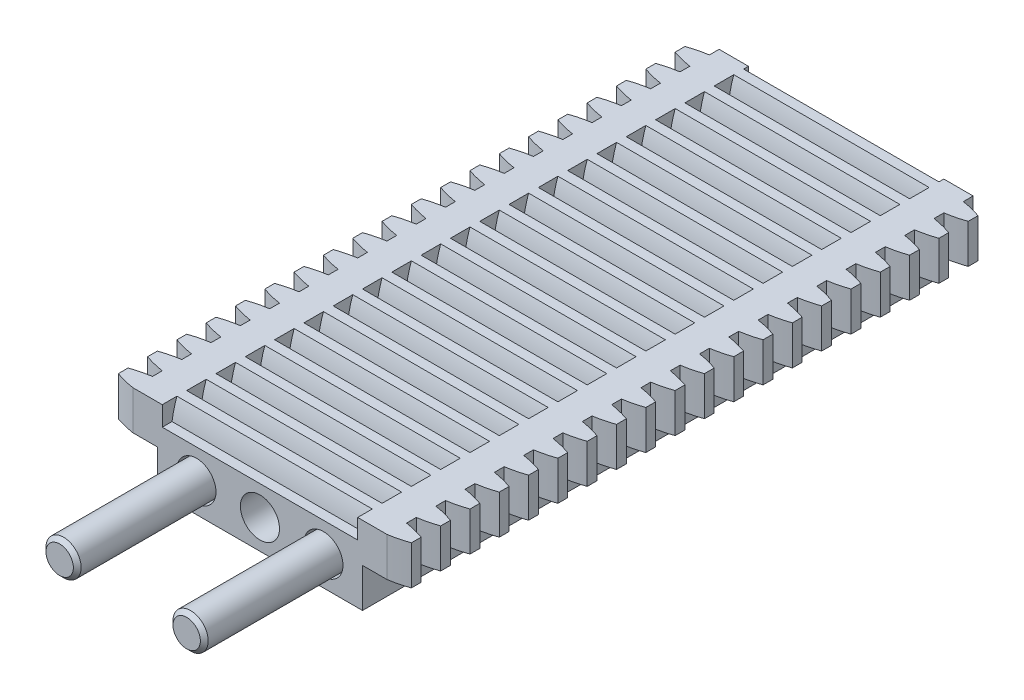
from build123d import *

# Parameters (mm, degrees)
EXTRUDE_1_DEPTH        = 60
EXTRUDE_START          = -3
EXTRUDE_2_DEPTH        = 54
SKETCH_3_R             = 1
CUT_EXTRUDE_1_DEPTH    = 61.483468816
EXTRUDE_3_DEPTH        = 7
EXTRUDE_3_DEPTH_BACK   = 7
SKETCH_4_R             = 0.9
EXTRUDE_3_2_DEPTH      = 7
EXTRUDE_3_2_DEPTH_BACK = 7
FILLET_1_R             = 0.1
CHAMFER_2_SIZE         = 0.2
CHAMFER_3_SIZE         = 0.2
EXTRUDE_4_DEPTH        = 2
CUT_EXTRUDE_2_DEPTH    = 5
CUT_EXTRUDE_START      = 5
CUT_EXTRUDE_3_DEPTH    = 5
CUT_EXTRUDE_4_DEPTH    = 61.815294129
CUT_EXTRUDE_5_DEPTH    = 3


with BuildPart() as part:
    # 草图1 → 凸台-拉伸1 (new body)
    with BuildSketch(Plane.XY):
        Polygon((5.25, 2), (6.5, 2), (6.5, 4), (-6.5, 4), (-6.5, 2), (-5.25, 2), (-5.25, 0), (5.25, 0), align=None)
    extrude(amount=-EXTRUDE_1_DEPTH)

    # 草图2 → 凸台-拉伸2 (add)
    with BuildSketch(Plane.XY.offset(EXTRUDE_START)):
        with BuildLine():
            Line((-1.95, -1.555590279), (-1.95, -2.5))
            Line((-1.95, -2.5), (-1.165769145, -2.5))
            Line((-1.165769145, -2.5), (0, 0))
            Line((0, 0), (-1.5, 0))
            Line((-1.5, 0), (-1.5, -0.677124344))
            ThreePointArc((-1.5, -0.677124344), (-1.780042303, -1.088161527), (-1.95, -1.555590279))
        make_face()
        with BuildLine():
            Line((1.5, 0), (0, 0))
            Line((0, 0), (1.165769145, -2.5))
            Line((1.165769145, -2.5), (1.95, -2.5))
            Line((1.95, -2.5), (1.95, -1.555590279))
            ThreePointArc((1.95, -1.555590279), (1.780042303, -1.088161527), (1.5, -0.677124344))
            Line((1.5, -0.677124344), (1.5, 0))
        make_face()
    extrude(amount=-EXTRUDE_2_DEPTH)

    # 草图3 → 切除-拉伸1 (cut, through all)
    with BuildSketch(Plane.XY):
        with Locations((-3.25, 1.5)):
            Circle(SKETCH_3_R)
        with Locations((0, 1.5)):
            Circle(SKETCH_3_R)
        with Locations((3.25, 1.5)):
            Circle(SKETCH_3_R)
    extrude(amount=-CUT_EXTRUDE_1_DEPTH, mode=Mode.SUBTRACT)

    # 圆角1
    fillet_1_edges = [part.edges().sort_by_distance(p)[0] for p in [
        (-1.557884573, -2.5, -57),
        (-1.165769145, -2.5, -30),
        (-1.95, -2.5, -30),
        (-1.557884573, -2.5, -3),
        (1.557884573, -2.5, -57),
        (1.95, -2.5, -30),
        (1.165769145, -2.5, -30),
        (1.557884573, -2.5, -3),
    ]]
    fillet(fillet_1_edges, radius=FILLET_1_R)

    # 草图6 → 凸台-拉伸4 (add)
    with BuildSketch(Plane(origin=(0, 4, 0), x_dir=(1, 0, 0), z_dir=(0, 1, 0))):
        with BuildLine():
            Line((-6.5, 59.5), (-6.5, 58.5))
            ThreePointArc((-6.5, 58.5), (-7.005883165, 58.601467338), (-7.5, 58.75))
            Line((-7.5, 58.75), (-7.5, 59.25))
            ThreePointArc((-7.5, 59.25), (-7.005883165, 59.398532662), (-6.5, 59.5))
        make_face()
        with BuildLine():
            Line((-6.5, 58), (-6.5, 57))
            ThreePointArc((-6.5, 57), (-7.005883165, 57.101467338), (-7.5, 57.25))
            Line((-7.5, 57.25), (-7.5, 57.75))
            ThreePointArc((-7.5, 57.75), (-7.005883165, 57.898532662), (-6.5, 58))
        make_face()
        with BuildLine():
            Line((-7.5, 56.25), (-7.5, 55.75))
            ThreePointArc((-7.5, 55.75), (-7.005883165, 55.601467338), (-6.5, 55.5))
            Line((-6.5, 55.5), (-6.5, 56.5))
            ThreePointArc((-6.5, 56.5), (-7.005883165, 56.398532662), (-7.5, 56.25))
        make_face()
        with BuildLine():
            Line((-7.5, 54.75), (-7.5, 54.25))
            ThreePointArc((-7.5, 54.25), (-7.005883165, 54.101467338), (-6.5, 54))
            Line((-6.5, 54), (-6.5, 55))
            ThreePointArc((-6.5, 55), (-7.005883165, 54.898532662), (-7.5, 54.75))
        make_face()
        with BuildLine():
            Line((-7.5, 53.25), (-7.5, 52.75))
            ThreePointArc((-7.5, 52.75), (-7.005883165, 52.601467338), (-6.5, 52.5))
            Line((-6.5, 52.5), (-6.5, 53.5))
            ThreePointArc((-6.5, 53.5), (-7.005883165, 53.398532662), (-7.5, 53.25))
        make_face()
        with BuildLine():
            Line((-7.5, 51.75), (-7.5, 51.25))
            ThreePointArc((-7.5, 51.25), (-7.005883165, 51.101467338), (-6.5, 51))
            Line((-6.5, 51), (-6.5, 52))
            ThreePointArc((-6.5, 52), (-7.005883165, 51.898532662), (-7.5, 51.75))
        make_face()
        with BuildLine():
            Line((-7.5, 50.25), (-7.5, 49.75))
            ThreePointArc((-7.5, 49.75), (-7.005883165, 49.601467338), (-6.5, 49.5))
            Line((-6.5, 49.5), (-6.5, 50.5))
            ThreePointArc((-6.5, 50.5), (-7.005883165, 50.398532662), (-7.5, 50.25))
        make_face()
        with BuildLine():
            Line((-7.5, 48.75), (-7.5, 48.25))
            ThreePointArc((-7.5, 48.25), (-7.005883165, 48.101467338), (-6.5, 48))
            Line((-6.5, 48), (-6.5, 49))
            ThreePointArc((-6.5, 49), (-7.005883165, 48.898532662), (-7.5, 48.75))
        make_face()
        with BuildLine():
            Line((-7.5, 47.25), (-7.5, 46.75))
            ThreePointArc((-7.5, 46.75), (-7.005883165, 46.601467338), (-6.5, 46.5))
            Line((-6.5, 46.5), (-6.5, 47.5))
            ThreePointArc((-6.5, 47.5), (-7.005883165, 47.398532662), (-7.5, 47.25))
        make_face()
        with BuildLine():
            Line((-7.5, 45.75), (-7.5, 45.25))
            ThreePointArc((-7.5, 45.25), (-7.005883165, 45.101467338), (-6.5, 45))
            Line((-6.5, 45), (-6.5, 46))
            ThreePointArc((-6.5, 46), (-7.005883165, 45.898532662), (-7.5, 45.75))
        make_face()
        with BuildLine():
            Line((-7.5, 44.25), (-7.5, 43.75))
            ThreePointArc((-7.5, 43.75), (-7.005883165, 43.601467338), (-6.5, 43.5))
            Line((-6.5, 43.5), (-6.5, 44.5))
            ThreePointArc((-6.5, 44.5), (-7.005883165, 44.398532662), (-7.5, 44.25))
        make_face()
        with BuildLine():
            Line((-7.5, 42.75), (-7.5, 42.25))
            ThreePointArc((-7.5, 42.25), (-7.005883165, 42.101467338), (-6.5, 42))
            Line((-6.5, 42), (-6.5, 43))
            ThreePointArc((-6.5, 43), (-7.005883165, 42.898532662), (-7.5, 42.75))
        make_face()
        with BuildLine():
            Line((-7.5, 41.25), (-7.5, 40.75))
            ThreePointArc((-7.5, 40.75), (-7.005883165, 40.601467338), (-6.5, 40.5))
            Line((-6.5, 40.5), (-6.5, 41.5))
            ThreePointArc((-6.5, 41.5), (-7.005883165, 41.398532662), (-7.5, 41.25))
        make_face()
        with BuildLine():
            Line((-7.5, 39.75), (-7.5, 39.25))
            ThreePointArc((-7.5, 39.25), (-7.005883165, 39.101467338), (-6.5, 39))
            Line((-6.5, 39), (-6.5, 40))
            ThreePointArc((-6.5, 40), (-7.005883165, 39.898532662), (-7.5, 39.75))
        make_face()
        with BuildLine():
            Line((-7.5, 38.25), (-7.5, 37.75))
            ThreePointArc((-7.5, 37.75), (-7.005883165, 37.601467338), (-6.5, 37.5))
            Line((-6.5, 37.5), (-6.5, 38.5))
            ThreePointArc((-6.5, 38.5), (-7.005883165, 38.398532662), (-7.5, 38.25))
        make_face()
        with BuildLine():
            Line((-7.5, 36.75), (-7.5, 36.25))
            ThreePointArc((-7.5, 36.25), (-7.005883165, 36.101467338), (-6.5, 36))
            Line((-6.5, 36), (-6.5, 37))
            ThreePointArc((-6.5, 37), (-7.005883165, 36.898532662), (-7.5, 36.75))
        make_face()
        with BuildLine():
            Line((-7.5, 35.25), (-7.5, 34.75))
            ThreePointArc((-7.5, 34.75), (-7.005883165, 34.601467338), (-6.5, 34.5))
            Line((-6.5, 34.5), (-6.5, 35.5))
            ThreePointArc((-6.5, 35.5), (-7.005883165, 35.398532662), (-7.5, 35.25))
        make_face()
        with BuildLine():
            Line((-7.5, 33.75), (-7.5, 33.25))
            ThreePointArc((-7.5, 33.25), (-7.005883165, 33.101467338), (-6.5, 33))
            Line((-6.5, 33), (-6.5, 34))
            ThreePointArc((-6.5, 34), (-7.005883165, 33.898532662), (-7.5, 33.75))
        make_face()
        with BuildLine():
            Line((-7.5, 32.25), (-7.5, 31.75))
            ThreePointArc((-7.5, 31.75), (-7.005883165, 31.601467338), (-6.5, 31.5))
            Line((-6.5, 31.5), (-6.5, 32.5))
            ThreePointArc((-6.5, 32.5), (-7.005883165, 32.398532662), (-7.5, 32.25))
        make_face()
        with BuildLine():
            Line((-7.5, 30.75), (-7.5, 30.25))
            ThreePointArc((-7.5, 30.25), (-7.005883165, 30.101467338), (-6.5, 30))
            Line((-6.5, 30), (-6.5, 31))
            ThreePointArc((-6.5, 31), (-7.005883165, 30.898532662), (-7.5, 30.75))
        make_face()
        with BuildLine():
            Line((-7.5, 29.25), (-7.5, 28.75))
            ThreePointArc((-7.5, 28.75), (-7.005883165, 28.601467338), (-6.5, 28.5))
            Line((-6.5, 28.5), (-6.5, 29.5))
            ThreePointArc((-6.5, 29.5), (-7.005883165, 29.398532662), (-7.5, 29.25))
        make_face()
        with BuildLine():
            Line((-7.5, 27.75), (-7.5, 27.25))
            ThreePointArc((-7.5, 27.25), (-7.005883165, 27.101467338), (-6.5, 27))
            Line((-6.5, 27), (-6.5, 28))
            ThreePointArc((-6.5, 28), (-7.005883165, 27.898532662), (-7.5, 27.75))
        make_face()
        with BuildLine():
            Line((-7.5, 26.25), (-7.5, 25.75))
            ThreePointArc((-7.5, 25.75), (-7.005883165, 25.601467338), (-6.5, 25.5))
            Line((-6.5, 25.5), (-6.5, 26.5))
            ThreePointArc((-6.5, 26.5), (-7.005883165, 26.398532662), (-7.5, 26.25))
        make_face()
        with BuildLine():
            Line((-7.5, 24.75), (-7.5, 24.25))
            ThreePointArc((-7.5, 24.25), (-7.005883165, 24.101467338), (-6.5, 24))
            Line((-6.5, 24), (-6.5, 25))
            ThreePointArc((-6.5, 25), (-7.005883165, 24.898532662), (-7.5, 24.75))
        make_face()
        with BuildLine():
            Line((-7.5, 23.25), (-7.5, 22.75))
            ThreePointArc((-7.5, 22.75), (-7.005883165, 22.601467338), (-6.5, 22.5))
            Line((-6.5, 22.5), (-6.5, 23.5))
            ThreePointArc((-6.5, 23.5), (-7.005883165, 23.398532662), (-7.5, 23.25))
        make_face()
        with BuildLine():
            Line((-7.5, 21.75), (-7.5, 21.25))
            ThreePointArc((-7.5, 21.25), (-7.005883165, 21.101467338), (-6.5, 21))
            Line((-6.5, 21), (-6.5, 22))
            ThreePointArc((-6.5, 22), (-7.005883165, 21.898532662), (-7.5, 21.75))
        make_face()
        with BuildLine():
            Line((-7.5, 20.25), (-7.5, 19.75))
            ThreePointArc((-7.5, 19.75), (-7.005883165, 19.601467338), (-6.5, 19.5))
            Line((-6.5, 19.5), (-6.5, 20.5))
            ThreePointArc((-6.5, 20.5), (-7.005883165, 20.398532662), (-7.5, 20.25))
        make_face()
        with BuildLine():
            Line((-7.5, 18.75), (-7.5, 18.25))
            ThreePointArc((-7.5, 18.25), (-7.005883165, 18.101467338), (-6.5, 18))
            Line((-6.5, 18), (-6.5, 19))
            ThreePointArc((-6.5, 19), (-7.005883165, 18.898532662), (-7.5, 18.75))
        make_face()
        with BuildLine():
            Line((-7.5, 17.25), (-7.5, 16.75))
            ThreePointArc((-7.5, 16.75), (-7.005883165, 16.601467338), (-6.5, 16.5))
            Line((-6.5, 16.5), (-6.5, 17.5))
            ThreePointArc((-6.5, 17.5), (-7.005883165, 17.398532662), (-7.5, 17.25))
        make_face()
        with BuildLine():
            Line((-7.5, 15.75), (-7.5, 15.25))
            ThreePointArc((-7.5, 15.25), (-7.005883165, 15.101467338), (-6.5, 15))
            Line((-6.5, 15), (-6.5, 16))
            ThreePointArc((-6.5, 16), (-7.005883165, 15.898532662), (-7.5, 15.75))
        make_face()
        with BuildLine():
            Line((-7.5, 14.25), (-7.5, 13.75))
            ThreePointArc((-7.5, 13.75), (-7.005883165, 13.601467338), (-6.5, 13.5))
            Line((-6.5, 13.5), (-6.5, 14.5))
            ThreePointArc((-6.5, 14.5), (-7.005883165, 14.398532662), (-7.5, 14.25))
        make_face()
        with BuildLine():
            Line((-7.5, 12.75), (-7.5, 12.25))
            ThreePointArc((-7.5, 12.25), (-7.005883165, 12.101467338), (-6.5, 12))
            Line((-6.5, 12), (-6.5, 13))
            ThreePointArc((-6.5, 13), (-7.005883165, 12.898532662), (-7.5, 12.75))
        make_face()
        with BuildLine():
            Line((-7.5, 11.25), (-7.5, 10.75))
            ThreePointArc((-7.5, 10.75), (-7.005883165, 10.601467338), (-6.5, 10.5))
            Line((-6.5, 10.5), (-6.5, 11.5))
            ThreePointArc((-6.5, 11.5), (-7.005883165, 11.398532662), (-7.5, 11.25))
        make_face()
        with BuildLine():
            Line((-7.5, 9.75), (-7.5, 9.25))
            ThreePointArc((-7.5, 9.25), (-7.005883165, 9.101467338), (-6.5, 9))
            Line((-6.5, 9), (-6.5, 10))
            ThreePointArc((-6.5, 10), (-7.005883165, 9.898532662), (-7.5, 9.75))
        make_face()
        with BuildLine():
            Line((-7.5, 8.25), (-7.5, 7.75))
            ThreePointArc((-7.5, 7.75), (-7.005883165, 7.601467338), (-6.5, 7.5))
            Line((-6.5, 7.5), (-6.5, 8.5))
            ThreePointArc((-6.5, 8.5), (-7.005883165, 8.398532662), (-7.5, 8.25))
        make_face()
        with BuildLine():
            Line((-7.5, 6.75), (-7.5, 6.25))
            ThreePointArc((-7.5, 6.25), (-7.005883165, 6.101467338), (-6.5, 6))
            Line((-6.5, 6), (-6.5, 7))
            ThreePointArc((-6.5, 7), (-7.005883165, 6.898532662), (-7.5, 6.75))
        make_face()
        with BuildLine():
            Line((-7.5, 5.25), (-7.5, 4.75))
            ThreePointArc((-7.5, 4.75), (-7.005883165, 4.601467338), (-6.5, 4.5))
            Line((-6.5, 4.5), (-6.5, 5.5))
            ThreePointArc((-6.5, 5.5), (-7.005883165, 5.398532662), (-7.5, 5.25))
        make_face()
        with BuildLine():
            Line((-7.5, 3.75), (-7.5, 3.25))
            ThreePointArc((-7.5, 3.25), (-7.005883165, 3.101467338), (-6.5, 3))
            Line((-6.5, 3), (-6.5, 4))
            ThreePointArc((-6.5, 4), (-7.005883165, 3.898532662), (-7.5, 3.75))
        make_face()
        with BuildLine():
            Line((-7.5, 2.25), (-7.5, 1.75))
            ThreePointArc((-7.5, 1.75), (-7.005883165, 1.601467338), (-6.5, 1.5))
            Line((-6.5, 1.5), (-6.5, 2.5))
            ThreePointArc((-6.5, 2.5), (-7.005883165, 2.398532662), (-7.5, 2.25))
        make_face()
        with BuildLine():
            Line((-6.5, 1), (-6.5, 0))
            ThreePointArc((-6.5, 0), (-7.005883165, 0.101467338), (-7.5, 0.25))
            Line((-7.5, 0.25), (-7.5, 0.75))
            ThreePointArc((-7.5, 0.75), (-7.005883165, 0.898532662), (-6.5, 1))
        make_face()
        with BuildLine():
            Line((7.5, 0.75), (7.5, 0.25))
            ThreePointArc((7.5, 0.25), (7.005883165, 0.101467338), (6.5, 0))
            Line((6.5, 0), (6.5, 1))
            ThreePointArc((6.5, 1), (7.005883165, 0.898532662), (7.5, 0.75))
        make_face()
        with BuildLine():
            Line((6.5, 2.5), (6.5, 1.5))
            ThreePointArc((6.5, 1.5), (7.005883165, 1.601467338), (7.5, 1.75))
            Line((7.5, 1.75), (7.5, 2.25))
            ThreePointArc((7.5, 2.25), (7.005883165, 2.398532662), (6.5, 2.5))
        make_face()
        with BuildLine():
            Line((6.5, 4), (6.5, 3))
            ThreePointArc((6.5, 3), (7.005883165, 3.101467338), (7.5, 3.25))
            Line((7.5, 3.25), (7.5, 3.75))
            ThreePointArc((7.5, 3.75), (7.005883165, 3.898532662), (6.5, 4))
        make_face()
        with BuildLine():
            Line((6.5, 5.5), (6.5, 4.5))
            ThreePointArc((6.5, 4.5), (7.005883165, 4.601467338), (7.5, 4.75))
            Line((7.5, 4.75), (7.5, 5.25))
            ThreePointArc((7.5, 5.25), (7.005883165, 5.398532662), (6.5, 5.5))
        make_face()
        with BuildLine():
            Line((6.5, 7), (6.5, 6))
            ThreePointArc((6.5, 6), (7.005883165, 6.101467338), (7.5, 6.25))
            Line((7.5, 6.25), (7.5, 6.75))
            ThreePointArc((7.5, 6.75), (7.005883165, 6.898532662), (6.5, 7))
        make_face()
        with BuildLine():
            Line((6.5, 8.5), (6.5, 7.5))
            ThreePointArc((6.5, 7.5), (7.005883165, 7.601467338), (7.5, 7.75))
            Line((7.5, 7.75), (7.5, 8.25))
            ThreePointArc((7.5, 8.25), (7.005883165, 8.398532662), (6.5, 8.5))
        make_face()
        with BuildLine():
            Line((6.5, 10), (6.5, 9))
            ThreePointArc((6.5, 9), (7.005883165, 9.101467338), (7.5, 9.25))
            Line((7.5, 9.25), (7.5, 9.75))
            ThreePointArc((7.5, 9.75), (7.005883165, 9.898532662), (6.5, 10))
        make_face()
        with BuildLine():
            Line((6.5, 11.5), (6.5, 10.5))
            ThreePointArc((6.5, 10.5), (7.005883165, 10.601467338), (7.5, 10.75))
            Line((7.5, 10.75), (7.5, 11.25))
            ThreePointArc((7.5, 11.25), (7.005883165, 11.398532662), (6.5, 11.5))
        make_face()
        with BuildLine():
            Line((6.5, 13), (6.5, 12))
            ThreePointArc((6.5, 12), (7.005883165, 12.101467338), (7.5, 12.25))
            Line((7.5, 12.25), (7.5, 12.75))
            ThreePointArc((7.5, 12.75), (7.005883165, 12.898532662), (6.5, 13))
        make_face()
        with BuildLine():
            Line((6.5, 14.5), (6.5, 13.5))
            ThreePointArc((6.5, 13.5), (7.005883165, 13.601467338), (7.5, 13.75))
            Line((7.5, 13.75), (7.5, 14.25))
            ThreePointArc((7.5, 14.25), (7.005883165, 14.398532662), (6.5, 14.5))
        make_face()
        with BuildLine():
            Line((6.5, 16), (6.5, 15))
            ThreePointArc((6.5, 15), (7.005883165, 15.101467338), (7.5, 15.25))
            Line((7.5, 15.25), (7.5, 15.75))
            ThreePointArc((7.5, 15.75), (7.005883165, 15.898532662), (6.5, 16))
        make_face()
        with BuildLine():
            Line((6.5, 17.5), (6.5, 16.5))
            ThreePointArc((6.5, 16.5), (7.005883165, 16.601467338), (7.5, 16.75))
            Line((7.5, 16.75), (7.5, 17.25))
            ThreePointArc((7.5, 17.25), (7.005883165, 17.398532662), (6.5, 17.5))
        make_face()
        with BuildLine():
            Line((6.5, 19), (6.5, 18))
            ThreePointArc((6.5, 18), (7.005883165, 18.101467338), (7.5, 18.25))
            Line((7.5, 18.25), (7.5, 18.75))
            ThreePointArc((7.5, 18.75), (7.005883165, 18.898532662), (6.5, 19))
        make_face()
        with BuildLine():
            Line((6.5, 20.5), (6.5, 19.5))
            ThreePointArc((6.5, 19.5), (7.005883165, 19.601467338), (7.5, 19.75))
            Line((7.5, 19.75), (7.5, 20.25))
            ThreePointArc((7.5, 20.25), (7.005883165, 20.398532662), (6.5, 20.5))
        make_face()
        with BuildLine():
            Line((6.5, 22), (6.5, 21))
            ThreePointArc((6.5, 21), (7.005883165, 21.101467338), (7.5, 21.25))
            Line((7.5, 21.25), (7.5, 21.75))
            ThreePointArc((7.5, 21.75), (7.005883165, 21.898532662), (6.5, 22))
        make_face()
        with BuildLine():
            Line((6.5, 23.5), (6.5, 22.5))
            ThreePointArc((6.5, 22.5), (7.005883165, 22.601467338), (7.5, 22.75))
            Line((7.5, 22.75), (7.5, 23.25))
            ThreePointArc((7.5, 23.25), (7.005883165, 23.398532662), (6.5, 23.5))
        make_face()
        with BuildLine():
            Line((6.5, 25), (6.5, 24))
            ThreePointArc((6.5, 24), (7.005883165, 24.101467338), (7.5, 24.25))
            Line((7.5, 24.25), (7.5, 24.75))
            ThreePointArc((7.5, 24.75), (7.005883165, 24.898532662), (6.5, 25))
        make_face()
        with BuildLine():
            Line((6.5, 26.5), (6.5, 25.5))
            ThreePointArc((6.5, 25.5), (7.005883165, 25.601467338), (7.5, 25.75))
            Line((7.5, 25.75), (7.5, 26.25))
            ThreePointArc((7.5, 26.25), (7.005883165, 26.398532662), (6.5, 26.5))
        make_face()
        with BuildLine():
            Line((6.5, 28), (6.5, 27))
            ThreePointArc((6.5, 27), (7.005883165, 27.101467338), (7.5, 27.25))
            Line((7.5, 27.25), (7.5, 27.75))
            ThreePointArc((7.5, 27.75), (7.005883165, 27.898532662), (6.5, 28))
        make_face()
        with BuildLine():
            Line((6.5, 29.5), (6.5, 28.5))
            ThreePointArc((6.5, 28.5), (7.005883165, 28.601467338), (7.5, 28.75))
            Line((7.5, 28.75), (7.5, 29.25))
            ThreePointArc((7.5, 29.25), (7.005883165, 29.398532662), (6.5, 29.5))
        make_face()
        with BuildLine():
            Line((6.5, 31), (6.5, 30))
            ThreePointArc((6.5, 30), (7.005883165, 30.101467338), (7.5, 30.25))
            Line((7.5, 30.25), (7.5, 30.75))
            ThreePointArc((7.5, 30.75), (7.005883165, 30.898532662), (6.5, 31))
        make_face()
        with BuildLine():
            Line((6.5, 32.5), (6.5, 31.5))
            ThreePointArc((6.5, 31.5), (7.005883165, 31.601467338), (7.5, 31.75))
            Line((7.5, 31.75), (7.5, 32.25))
            ThreePointArc((7.5, 32.25), (7.005883165, 32.398532662), (6.5, 32.5))
        make_face()
        with BuildLine():
            Line((6.5, 34), (6.5, 33))
            ThreePointArc((6.5, 33), (7.005883165, 33.101467338), (7.5, 33.25))
            Line((7.5, 33.25), (7.5, 33.75))
            ThreePointArc((7.5, 33.75), (7.005883165, 33.898532662), (6.5, 34))
        make_face()
        with BuildLine():
            Line((6.5, 35.5), (6.5, 34.5))
            ThreePointArc((6.5, 34.5), (7.005883165, 34.601467338), (7.5, 34.75))
            Line((7.5, 34.75), (7.5, 35.25))
            ThreePointArc((7.5, 35.25), (7.005883165, 35.398532662), (6.5, 35.5))
        make_face()
        with BuildLine():
            Line((6.5, 37), (6.5, 36))
            ThreePointArc((6.5, 36), (7.005883165, 36.101467338), (7.5, 36.25))
            Line((7.5, 36.25), (7.5, 36.75))
            ThreePointArc((7.5, 36.75), (7.005883165, 36.898532662), (6.5, 37))
        make_face()
        with BuildLine():
            Line((6.5, 38.5), (6.5, 37.5))
            ThreePointArc((6.5, 37.5), (7.005883165, 37.601467338), (7.5, 37.75))
            Line((7.5, 37.75), (7.5, 38.25))
            ThreePointArc((7.5, 38.25), (7.005883165, 38.398532662), (6.5, 38.5))
        make_face()
        with BuildLine():
            Line((6.5, 40), (6.5, 39))
            ThreePointArc((6.5, 39), (7.005883165, 39.101467338), (7.5, 39.25))
            Line((7.5, 39.25), (7.5, 39.75))
            ThreePointArc((7.5, 39.75), (7.005883165, 39.898532662), (6.5, 40))
        make_face()
        with BuildLine():
            Line((6.5, 41.5), (6.5, 40.5))
            ThreePointArc((6.5, 40.5), (7.005883165, 40.601467338), (7.5, 40.75))
            Line((7.5, 40.75), (7.5, 41.25))
            ThreePointArc((7.5, 41.25), (7.005883165, 41.398532662), (6.5, 41.5))
        make_face()
        with BuildLine():
            Line((6.5, 43), (6.5, 42))
            ThreePointArc((6.5, 42), (7.005883165, 42.101467338), (7.5, 42.25))
            Line((7.5, 42.25), (7.5, 42.75))
            ThreePointArc((7.5, 42.75), (7.005883165, 42.898532662), (6.5, 43))
        make_face()
        with BuildLine():
            Line((6.5, 44.5), (6.5, 43.5))
            ThreePointArc((6.5, 43.5), (7.005883165, 43.601467338), (7.5, 43.75))
            Line((7.5, 43.75), (7.5, 44.25))
            ThreePointArc((7.5, 44.25), (7.005883165, 44.398532662), (6.5, 44.5))
        make_face()
        with BuildLine():
            Line((6.5, 46), (6.5, 45))
            ThreePointArc((6.5, 45), (7.005883165, 45.101467338), (7.5, 45.25))
            Line((7.5, 45.25), (7.5, 45.75))
            ThreePointArc((7.5, 45.75), (7.005883165, 45.898532662), (6.5, 46))
        make_face()
        with BuildLine():
            Line((6.5, 47.5), (6.5, 46.5))
            ThreePointArc((6.5, 46.5), (7.005883165, 46.601467338), (7.5, 46.75))
            Line((7.5, 46.75), (7.5, 47.25))
            ThreePointArc((7.5, 47.25), (7.005883165, 47.398532662), (6.5, 47.5))
        make_face()
        with BuildLine():
            Line((6.5, 49), (6.5, 48))
            ThreePointArc((6.5, 48), (7.005883165, 48.101467338), (7.5, 48.25))
            Line((7.5, 48.25), (7.5, 48.75))
            ThreePointArc((7.5, 48.75), (7.005883165, 48.898532662), (6.5, 49))
        make_face()
        with BuildLine():
            Line((6.5, 50.5), (6.5, 49.5))
            ThreePointArc((6.5, 49.5), (7.005883165, 49.601467338), (7.5, 49.75))
            Line((7.5, 49.75), (7.5, 50.25))
            ThreePointArc((7.5, 50.25), (7.005883165, 50.398532662), (6.5, 50.5))
        make_face()
        with BuildLine():
            Line((6.5, 52), (6.5, 51))
            ThreePointArc((6.5, 51), (7.005883165, 51.101467338), (7.5, 51.25))
            Line((7.5, 51.25), (7.5, 51.75))
            ThreePointArc((7.5, 51.75), (7.005883165, 51.898532662), (6.5, 52))
        make_face()
        with BuildLine():
            Line((6.5, 53.5), (6.5, 52.5))
            ThreePointArc((6.5, 52.5), (7.005883165, 52.601467338), (7.5, 52.75))
            Line((7.5, 52.75), (7.5, 53.25))
            ThreePointArc((7.5, 53.25), (7.005883165, 53.398532662), (6.5, 53.5))
        make_face()
        with BuildLine():
            Line((6.5, 55), (6.5, 54))
            ThreePointArc((6.5, 54), (7.005883165, 54.101467338), (7.5, 54.25))
            Line((7.5, 54.25), (7.5, 54.75))
            ThreePointArc((7.5, 54.75), (7.005883165, 54.898532662), (6.5, 55))
        make_face()
        with BuildLine():
            Line((6.5, 56.5), (6.5, 55.5))
            ThreePointArc((6.5, 55.5), (7.005883165, 55.601467338), (7.5, 55.75))
            Line((7.5, 55.75), (7.5, 56.25))
            ThreePointArc((7.5, 56.25), (7.005883165, 56.398532662), (6.5, 56.5))
        make_face()
        with BuildLine():
            Line((7.5, 57.75), (7.5, 57.25))
            ThreePointArc((7.5, 57.25), (7.005883165, 57.101467338), (6.5, 57))
            Line((6.5, 57), (6.5, 58))
            ThreePointArc((6.5, 58), (7.005883165, 57.898532662), (7.5, 57.75))
        make_face()
        with BuildLine():
            Line((7.5, 59.25), (7.5, 58.75))
            ThreePointArc((7.5, 58.75), (7.005883165, 58.601467338), (6.5, 58.5))
            Line((6.5, 58.5), (6.5, 59.5))
            ThreePointArc((6.5, 59.5), (7.005883165, 59.398532662), (7.5, 59.25))
        make_face()
    extrude(amount=-EXTRUDE_4_DEPTH)

    # 草图7 → 切除-拉伸2 (cut)
    with BuildSketch(Plane(origin=(0, 0, 0), x_dir=(0, 0, -1), z_dir=(1, 0, 0))):
        with BuildLine():
            Line((2.75, 4), (3.75, 4))
            ThreePointArc((3.75, 4), (3.601467338, 3.505883165), (3.5, 3))
            Line((3.5, 3), (3, 3))
            ThreePointArc((3, 3), (2.898532662, 3.505883165), (2.75, 4))
        make_face()
        with BuildLine():
            Line((4.25, 4), (5.25, 4))
            ThreePointArc((5.25, 4), (5.101467338, 3.505883165), (5, 3))
            Line((5, 3), (4.5, 3))
            ThreePointArc((4.5, 3), (4.398532662, 3.505883165), (4.25, 4))
        make_face()
        with BuildLine():
            Line((1.5, 3), (2, 3))
            ThreePointArc((2, 3), (2.101467338, 3.505883165), (2.25, 4))
            Line((2.25, 4), (1.25, 4))
            ThreePointArc((1.25, 4), (1.398532662, 3.505883165), (1.5, 3))
        make_face()
        with BuildLine():
            Line((0.5, 3), (0, 3))
            ThreePointArc((0, 3), (-0.101467338, 3.505883165), (-0.25, 4))
            Line((-0.25, 4), (0.75, 4))
            ThreePointArc((0.75, 4), (0.601467338, 3.505883165), (0.5, 3))
        make_face()
        with BuildLine():
            Line((5.75, 4), (6.75, 4))
            ThreePointArc((6.75, 4), (6.601467338, 3.505883165), (6.5, 3))
            Line((6.5, 3), (6, 3))
            ThreePointArc((6, 3), (5.898532662, 3.505883165), (5.75, 4))
        make_face()
        with BuildLine():
            Line((9, 3), (9.5, 3))
            ThreePointArc((9.5, 3), (9.601467338, 3.505883165), (9.75, 4))
            Line((9.75, 4), (8.75, 4))
            ThreePointArc((8.75, 4), (8.898532662, 3.505883165), (9, 3))
        make_face()
        with BuildLine():
            Line((11.75, 4), (12.75, 4))
            ThreePointArc((12.75, 4), (12.601467338, 3.505883165), (12.5, 3))
            Line((12.5, 3), (12, 3))
            ThreePointArc((12, 3), (11.898532662, 3.505883165), (11.75, 4))
        make_face()
        with BuildLine():
            Line((10.25, 4), (11.25, 4))
            ThreePointArc((11.25, 4), (11.101467338, 3.505883165), (11, 3))
            Line((11, 3), (10.5, 3))
            ThreePointArc((10.5, 3), (10.398532662, 3.505883165), (10.25, 4))
        make_face()
        with BuildLine():
            Line((7.25, 4), (8.25, 4))
            ThreePointArc((8.25, 4), (8.101467338, 3.505883165), (8, 3))
            Line((8, 3), (7.5, 3))
            ThreePointArc((7.5, 3), (7.398532662, 3.505883165), (7.25, 4))
        make_face()
        with BuildLine():
            Line((15, 3), (15.5, 3))
            ThreePointArc((15.5, 3), (15.601467338, 3.505883165), (15.75, 4))
            Line((15.75, 4), (14.75, 4))
            ThreePointArc((14.75, 4), (14.898532662, 3.505883165), (15, 3))
        make_face()
        with BuildLine():
            Line((17.75, 4), (18.75, 4))
            ThreePointArc((18.75, 4), (18.601467338, 3.505883165), (18.5, 3))
            Line((18.5, 3), (18, 3))
            ThreePointArc((18, 3), (17.898532662, 3.505883165), (17.75, 4))
        make_face()
        with BuildLine():
            Line((16.25, 4), (17.25, 4))
            ThreePointArc((17.25, 4), (17.101467338, 3.505883165), (17, 3))
            Line((17, 3), (16.5, 3))
            ThreePointArc((16.5, 3), (16.398532662, 3.505883165), (16.25, 4))
        make_face()
        with BuildLine():
            Line((13.25, 4), (14.25, 4))
            ThreePointArc((14.25, 4), (14.101467338, 3.505883165), (14, 3))
            Line((14, 3), (13.5, 3))
            ThreePointArc((13.5, 3), (13.398532662, 3.505883165), (13.25, 4))
        make_face()
        with BuildLine():
            Line((24, 3), (24.5, 3))
            ThreePointArc((24.5, 3), (24.601467338, 3.505883165), (24.75, 4))
            Line((24.75, 4), (23.75, 4))
            ThreePointArc((23.75, 4), (23.898532662, 3.505883165), (24, 3))
        make_face()
        with BuildLine():
            Line((20.75, 4), (21.75, 4))
            ThreePointArc((21.75, 4), (21.601467338, 3.505883165), (21.5, 3))
            Line((21.5, 3), (21, 3))
            ThreePointArc((21, 3), (20.898532662, 3.505883165), (20.75, 4))
        make_face()
        with BuildLine():
            Line((19.5, 3), (20, 3))
            ThreePointArc((20, 3), (20.101467338, 3.505883165), (20.25, 4))
            Line((20.25, 4), (19.25, 4))
            ThreePointArc((19.25, 4), (19.398532662, 3.505883165), (19.5, 3))
        make_face()
        with BuildLine():
            Line((22.25, 4), (23.25, 4))
            ThreePointArc((23.25, 4), (23.101467338, 3.505883165), (23, 3))
            Line((23, 3), (22.5, 3))
            ThreePointArc((22.5, 3), (22.398532662, 3.505883165), (22.25, 4))
        make_face()
        with BuildLine():
            Line((30, 3), (30.5, 3))
            ThreePointArc((30.5, 3), (30.601467338, 3.505883165), (30.75, 4))
            Line((30.75, 4), (29.75, 4))
            ThreePointArc((29.75, 4), (29.898532662, 3.505883165), (30, 3))
        make_face()
        with BuildLine():
            Line((26.75, 4), (27.75, 4))
            ThreePointArc((27.75, 4), (27.601467338, 3.505883165), (27.5, 3))
            Line((27.5, 3), (27, 3))
            ThreePointArc((27, 3), (26.898532662, 3.505883165), (26.75, 4))
        make_face()
        with BuildLine():
            Line((25.5, 3), (26, 3))
            ThreePointArc((26, 3), (26.101467338, 3.505883165), (26.25, 4))
            Line((26.25, 4), (25.25, 4))
            ThreePointArc((25.25, 4), (25.398532662, 3.505883165), (25.5, 3))
        make_face()
        with BuildLine():
            Line((28.25, 4), (29.25, 4))
            ThreePointArc((29.25, 4), (29.101467338, 3.505883165), (29, 3))
            Line((29, 3), (28.5, 3))
            ThreePointArc((28.5, 3), (28.398532662, 3.505883165), (28.25, 4))
        make_face()
        with BuildLine():
            Line((36, 3), (36.5, 3))
            ThreePointArc((36.5, 3), (36.601467338, 3.505883165), (36.75, 4))
            Line((36.75, 4), (35.75, 4))
            ThreePointArc((35.75, 4), (35.898532662, 3.505883165), (36, 3))
        make_face()
        with BuildLine():
            Line((32.75, 4), (33.75, 4))
            ThreePointArc((33.75, 4), (33.601467338, 3.505883165), (33.5, 3))
            Line((33.5, 3), (33, 3))
            ThreePointArc((33, 3), (32.898532662, 3.505883165), (32.75, 4))
        make_face()
        with BuildLine():
            Line((31.5, 3), (32, 3))
            ThreePointArc((32, 3), (32.101467338, 3.505883165), (32.25, 4))
            Line((32.25, 4), (31.25, 4))
            ThreePointArc((31.25, 4), (31.398532662, 3.505883165), (31.5, 3))
        make_face()
        with BuildLine():
            Line((34.25, 4), (35.25, 4))
            ThreePointArc((35.25, 4), (35.101467338, 3.505883165), (35, 3))
            Line((35, 3), (34.5, 3))
            ThreePointArc((34.5, 3), (34.398532662, 3.505883165), (34.25, 4))
        make_face()
        with BuildLine():
            Line((42, 3), (42.5, 3))
            ThreePointArc((42.5, 3), (42.601467338, 3.505883165), (42.75, 4))
            Line((42.75, 4), (41.75, 4))
            ThreePointArc((41.75, 4), (41.898532662, 3.505883165), (42, 3))
        make_face()
        with BuildLine():
            Line((38.75, 4), (39.75, 4))
            ThreePointArc((39.75, 4), (39.601467338, 3.505883165), (39.5, 3))
            Line((39.5, 3), (39, 3))
            ThreePointArc((39, 3), (38.898532662, 3.505883165), (38.75, 4))
        make_face()
        with BuildLine():
            Line((37.5, 3), (38, 3))
            ThreePointArc((38, 3), (38.101467338, 3.505883165), (38.25, 4))
            Line((38.25, 4), (37.25, 4))
            ThreePointArc((37.25, 4), (37.398532662, 3.505883165), (37.5, 3))
        make_face()
        with BuildLine():
            Line((40.25, 4), (41.25, 4))
            ThreePointArc((41.25, 4), (41.101467338, 3.505883165), (41, 3))
            Line((41, 3), (40.5, 3))
            ThreePointArc((40.5, 3), (40.398532662, 3.505883165), (40.25, 4))
        make_face()
        with BuildLine():
            Line((48, 3), (48.5, 3))
            ThreePointArc((48.5, 3), (48.601467338, 3.505883165), (48.75, 4))
            Line((48.75, 4), (47.75, 4))
            ThreePointArc((47.75, 4), (47.898532662, 3.505883165), (48, 3))
        make_face()
        with BuildLine():
            Line((44.75, 4), (45.75, 4))
            ThreePointArc((45.75, 4), (45.601467338, 3.505883165), (45.5, 3))
            Line((45.5, 3), (45, 3))
            ThreePointArc((45, 3), (44.898532662, 3.505883165), (44.75, 4))
        make_face()
        with BuildLine():
            Line((43.5, 3), (44, 3))
            ThreePointArc((44, 3), (44.101467338, 3.505883165), (44.25, 4))
            Line((44.25, 4), (43.25, 4))
            ThreePointArc((43.25, 4), (43.398532662, 3.505883165), (43.5, 3))
        make_face()
        with BuildLine():
            Line((46.25, 4), (47.25, 4))
            ThreePointArc((47.25, 4), (47.101467338, 3.505883165), (47, 3))
            Line((47, 3), (46.5, 3))
            ThreePointArc((46.5, 3), (46.398532662, 3.505883165), (46.25, 4))
        make_face()
        with BuildLine():
            Line((54, 3), (54.5, 3))
            ThreePointArc((54.5, 3), (54.601467338, 3.505883165), (54.75, 4))
            Line((54.75, 4), (53.75, 4))
            ThreePointArc((53.75, 4), (53.898532662, 3.505883165), (54, 3))
        make_face()
        with BuildLine():
            Line((50.75, 4), (51.75, 4))
            ThreePointArc((51.75, 4), (51.601467338, 3.505883165), (51.5, 3))
            Line((51.5, 3), (51, 3))
            ThreePointArc((51, 3), (50.898532662, 3.505883165), (50.75, 4))
        make_face()
        with BuildLine():
            Line((49.5, 3), (50, 3))
            ThreePointArc((50, 3), (50.101467338, 3.505883165), (50.25, 4))
            Line((50.25, 4), (49.25, 4))
            ThreePointArc((49.25, 4), (49.398532662, 3.505883165), (49.5, 3))
        make_face()
        with BuildLine():
            Line((52.25, 4), (53.25, 4))
            ThreePointArc((53.25, 4), (53.101467338, 3.505883165), (53, 3))
            Line((53, 3), (52.5, 3))
            ThreePointArc((52.5, 3), (52.398532662, 3.505883165), (52.25, 4))
        make_face()
        with BuildLine():
            Line((56.75, 4), (57.75, 4))
            ThreePointArc((57.75, 4), (57.601467338, 3.505883165), (57.5, 3))
            Line((57.5, 3), (57, 3))
            ThreePointArc((57, 3), (56.898532662, 3.505883165), (56.75, 4))
        make_face()
        with BuildLine():
            Line((55.5, 3), (56, 3))
            ThreePointArc((56, 3), (56.101467338, 3.505883165), (56.25, 4))
            Line((56.25, 4), (55.25, 4))
            ThreePointArc((55.25, 4), (55.398532662, 3.505883165), (55.5, 3))
        make_face()
        with BuildLine():
            Line((58.25, 4), (59.25, 4))
            ThreePointArc((59.25, 4), (59.101467338, 3.505883165), (59, 3))
            Line((59, 3), (58.5, 3))
            ThreePointArc((58.5, 3), (58.398532662, 3.505883165), (58.25, 4))
        make_face()
        with BuildLine():
            Line((60.5, 3), (60, 3))
            ThreePointArc((60, 3), (59.898532662, 3.505883165), (59.75, 4))
            Line((59.75, 4), (60.75, 4))
            ThreePointArc((60.75, 4), (60.601467338, 3.505883165), (60.5, 3))
        make_face()
    extrude(amount=-CUT_EXTRUDE_2_DEPTH, mode=Mode.SUBTRACT)

    # 草图7<2> → 切除-拉伸3 (cut)
    with BuildSketch(Plane(origin=(0, 0, 0), x_dir=(0, 0, -1), z_dir=(1, 0, 0)).offset(CUT_EXTRUDE_START)):
        with BuildLine():
            Line((2.75, 4), (3.75, 4))
            ThreePointArc((3.75, 4), (3.601467338, 3.505883165), (3.5, 3))
            Line((3.5, 3), (3, 3))
            ThreePointArc((3, 3), (2.898532662, 3.505883165), (2.75, 4))
        make_face()
        with BuildLine():
            Line((4.25, 4), (5.25, 4))
            ThreePointArc((5.25, 4), (5.101467338, 3.505883165), (5, 3))
            Line((5, 3), (4.5, 3))
            ThreePointArc((4.5, 3), (4.398532662, 3.505883165), (4.25, 4))
        make_face()
        with BuildLine():
            Line((1.5, 3), (2, 3))
            ThreePointArc((2, 3), (2.101467338, 3.505883165), (2.25, 4))
            Line((2.25, 4), (1.25, 4))
            ThreePointArc((1.25, 4), (1.398532662, 3.505883165), (1.5, 3))
        make_face()
        with BuildLine():
            Line((0.5, 3), (0, 3))
            ThreePointArc((0, 3), (-0.101467338, 3.505883165), (-0.25, 4))
            Line((-0.25, 4), (0.75, 4))
            ThreePointArc((0.75, 4), (0.601467338, 3.505883165), (0.5, 3))
        make_face()
        with BuildLine():
            Line((5.75, 4), (6.75, 4))
            ThreePointArc((6.75, 4), (6.601467338, 3.505883165), (6.5, 3))
            Line((6.5, 3), (6, 3))
            ThreePointArc((6, 3), (5.898532662, 3.505883165), (5.75, 4))
        make_face()
        with BuildLine():
            Line((9, 3), (9.5, 3))
            ThreePointArc((9.5, 3), (9.601467338, 3.505883165), (9.75, 4))
            Line((9.75, 4), (8.75, 4))
            ThreePointArc((8.75, 4), (8.898532662, 3.505883165), (9, 3))
        make_face()
        with BuildLine():
            Line((11.75, 4), (12.75, 4))
            ThreePointArc((12.75, 4), (12.601467338, 3.505883165), (12.5, 3))
            Line((12.5, 3), (12, 3))
            ThreePointArc((12, 3), (11.898532662, 3.505883165), (11.75, 4))
        make_face()
        with BuildLine():
            Line((10.25, 4), (11.25, 4))
            ThreePointArc((11.25, 4), (11.101467338, 3.505883165), (11, 3))
            Line((11, 3), (10.5, 3))
            ThreePointArc((10.5, 3), (10.398532662, 3.505883165), (10.25, 4))
        make_face()
        with BuildLine():
            Line((7.25, 4), (8.25, 4))
            ThreePointArc((8.25, 4), (8.101467338, 3.505883165), (8, 3))
            Line((8, 3), (7.5, 3))
            ThreePointArc((7.5, 3), (7.398532662, 3.505883165), (7.25, 4))
        make_face()
        with BuildLine():
            Line((15, 3), (15.5, 3))
            ThreePointArc((15.5, 3), (15.601467338, 3.505883165), (15.75, 4))
            Line((15.75, 4), (14.75, 4))
            ThreePointArc((14.75, 4), (14.898532662, 3.505883165), (15, 3))
        make_face()
        with BuildLine():
            Line((17.75, 4), (18.75, 4))
            ThreePointArc((18.75, 4), (18.601467338, 3.505883165), (18.5, 3))
            Line((18.5, 3), (18, 3))
            ThreePointArc((18, 3), (17.898532662, 3.505883165), (17.75, 4))
        make_face()
        with BuildLine():
            Line((16.25, 4), (17.25, 4))
            ThreePointArc((17.25, 4), (17.101467338, 3.505883165), (17, 3))
            Line((17, 3), (16.5, 3))
            ThreePointArc((16.5, 3), (16.398532662, 3.505883165), (16.25, 4))
        make_face()
        with BuildLine():
            Line((13.25, 4), (14.25, 4))
            ThreePointArc((14.25, 4), (14.101467338, 3.505883165), (14, 3))
            Line((14, 3), (13.5, 3))
            ThreePointArc((13.5, 3), (13.398532662, 3.505883165), (13.25, 4))
        make_face()
        with BuildLine():
            Line((24, 3), (24.5, 3))
            ThreePointArc((24.5, 3), (24.601467338, 3.505883165), (24.75, 4))
            Line((24.75, 4), (23.75, 4))
            ThreePointArc((23.75, 4), (23.898532662, 3.505883165), (24, 3))
        make_face()
        with BuildLine():
            Line((20.75, 4), (21.75, 4))
            ThreePointArc((21.75, 4), (21.601467338, 3.505883165), (21.5, 3))
            Line((21.5, 3), (21, 3))
            ThreePointArc((21, 3), (20.898532662, 3.505883165), (20.75, 4))
        make_face()
        with BuildLine():
            Line((19.5, 3), (20, 3))
            ThreePointArc((20, 3), (20.101467338, 3.505883165), (20.25, 4))
            Line((20.25, 4), (19.25, 4))
            ThreePointArc((19.25, 4), (19.398532662, 3.505883165), (19.5, 3))
        make_face()
        with BuildLine():
            Line((22.25, 4), (23.25, 4))
            ThreePointArc((23.25, 4), (23.101467338, 3.505883165), (23, 3))
            Line((23, 3), (22.5, 3))
            ThreePointArc((22.5, 3), (22.398532662, 3.505883165), (22.25, 4))
        make_face()
        with BuildLine():
            Line((30, 3), (30.5, 3))
            ThreePointArc((30.5, 3), (30.601467338, 3.505883165), (30.75, 4))
            Line((30.75, 4), (29.75, 4))
            ThreePointArc((29.75, 4), (29.898532662, 3.505883165), (30, 3))
        make_face()
        with BuildLine():
            Line((26.75, 4), (27.75, 4))
            ThreePointArc((27.75, 4), (27.601467338, 3.505883165), (27.5, 3))
            Line((27.5, 3), (27, 3))
            ThreePointArc((27, 3), (26.898532662, 3.505883165), (26.75, 4))
        make_face()
        with BuildLine():
            Line((25.5, 3), (26, 3))
            ThreePointArc((26, 3), (26.101467338, 3.505883165), (26.25, 4))
            Line((26.25, 4), (25.25, 4))
            ThreePointArc((25.25, 4), (25.398532662, 3.505883165), (25.5, 3))
        make_face()
        with BuildLine():
            Line((28.25, 4), (29.25, 4))
            ThreePointArc((29.25, 4), (29.101467338, 3.505883165), (29, 3))
            Line((29, 3), (28.5, 3))
            ThreePointArc((28.5, 3), (28.398532662, 3.505883165), (28.25, 4))
        make_face()
        with BuildLine():
            Line((36, 3), (36.5, 3))
            ThreePointArc((36.5, 3), (36.601467338, 3.505883165), (36.75, 4))
            Line((36.75, 4), (35.75, 4))
            ThreePointArc((35.75, 4), (35.898532662, 3.505883165), (36, 3))
        make_face()
        with BuildLine():
            Line((32.75, 4), (33.75, 4))
            ThreePointArc((33.75, 4), (33.601467338, 3.505883165), (33.5, 3))
            Line((33.5, 3), (33, 3))
            ThreePointArc((33, 3), (32.898532662, 3.505883165), (32.75, 4))
        make_face()
        with BuildLine():
            Line((31.5, 3), (32, 3))
            ThreePointArc((32, 3), (32.101467338, 3.505883165), (32.25, 4))
            Line((32.25, 4), (31.25, 4))
            ThreePointArc((31.25, 4), (31.398532662, 3.505883165), (31.5, 3))
        make_face()
        with BuildLine():
            Line((34.25, 4), (35.25, 4))
            ThreePointArc((35.25, 4), (35.101467338, 3.505883165), (35, 3))
            Line((35, 3), (34.5, 3))
            ThreePointArc((34.5, 3), (34.398532662, 3.505883165), (34.25, 4))
        make_face()
        with BuildLine():
            Line((42, 3), (42.5, 3))
            ThreePointArc((42.5, 3), (42.601467338, 3.505883165), (42.75, 4))
            Line((42.75, 4), (41.75, 4))
            ThreePointArc((41.75, 4), (41.898532662, 3.505883165), (42, 3))
        make_face()
        with BuildLine():
            Line((38.75, 4), (39.75, 4))
            ThreePointArc((39.75, 4), (39.601467338, 3.505883165), (39.5, 3))
            Line((39.5, 3), (39, 3))
            ThreePointArc((39, 3), (38.898532662, 3.505883165), (38.75, 4))
        make_face()
        with BuildLine():
            Line((37.5, 3), (38, 3))
            ThreePointArc((38, 3), (38.101467338, 3.505883165), (38.25, 4))
            Line((38.25, 4), (37.25, 4))
            ThreePointArc((37.25, 4), (37.398532662, 3.505883165), (37.5, 3))
        make_face()
        with BuildLine():
            Line((40.25, 4), (41.25, 4))
            ThreePointArc((41.25, 4), (41.101467338, 3.505883165), (41, 3))
            Line((41, 3), (40.5, 3))
            ThreePointArc((40.5, 3), (40.398532662, 3.505883165), (40.25, 4))
        make_face()
        with BuildLine():
            Line((48, 3), (48.5, 3))
            ThreePointArc((48.5, 3), (48.601467338, 3.505883165), (48.75, 4))
            Line((48.75, 4), (47.75, 4))
            ThreePointArc((47.75, 4), (47.898532662, 3.505883165), (48, 3))
        make_face()
        with BuildLine():
            Line((44.75, 4), (45.75, 4))
            ThreePointArc((45.75, 4), (45.601467338, 3.505883165), (45.5, 3))
            Line((45.5, 3), (45, 3))
            ThreePointArc((45, 3), (44.898532662, 3.505883165), (44.75, 4))
        make_face()
        with BuildLine():
            Line((43.5, 3), (44, 3))
            ThreePointArc((44, 3), (44.101467338, 3.505883165), (44.25, 4))
            Line((44.25, 4), (43.25, 4))
            ThreePointArc((43.25, 4), (43.398532662, 3.505883165), (43.5, 3))
        make_face()
        with BuildLine():
            Line((46.25, 4), (47.25, 4))
            ThreePointArc((47.25, 4), (47.101467338, 3.505883165), (47, 3))
            Line((47, 3), (46.5, 3))
            ThreePointArc((46.5, 3), (46.398532662, 3.505883165), (46.25, 4))
        make_face()
        with BuildLine():
            Line((54, 3), (54.5, 3))
            ThreePointArc((54.5, 3), (54.601467338, 3.505883165), (54.75, 4))
            Line((54.75, 4), (53.75, 4))
            ThreePointArc((53.75, 4), (53.898532662, 3.505883165), (54, 3))
        make_face()
        with BuildLine():
            Line((50.75, 4), (51.75, 4))
            ThreePointArc((51.75, 4), (51.601467338, 3.505883165), (51.5, 3))
            Line((51.5, 3), (51, 3))
            ThreePointArc((51, 3), (50.898532662, 3.505883165), (50.75, 4))
        make_face()
        with BuildLine():
            Line((49.5, 3), (50, 3))
            ThreePointArc((50, 3), (50.101467338, 3.505883165), (50.25, 4))
            Line((50.25, 4), (49.25, 4))
            ThreePointArc((49.25, 4), (49.398532662, 3.505883165), (49.5, 3))
        make_face()
        with BuildLine():
            Line((52.25, 4), (53.25, 4))
            ThreePointArc((53.25, 4), (53.101467338, 3.505883165), (53, 3))
            Line((53, 3), (52.5, 3))
            ThreePointArc((52.5, 3), (52.398532662, 3.505883165), (52.25, 4))
        make_face()
        with BuildLine():
            Line((56.75, 4), (57.75, 4))
            ThreePointArc((57.75, 4), (57.601467338, 3.505883165), (57.5, 3))
            Line((57.5, 3), (57, 3))
            ThreePointArc((57, 3), (56.898532662, 3.505883165), (56.75, 4))
        make_face()
        with BuildLine():
            Line((55.5, 3), (56, 3))
            ThreePointArc((56, 3), (56.101467338, 3.505883165), (56.25, 4))
            Line((56.25, 4), (55.25, 4))
            ThreePointArc((55.25, 4), (55.398532662, 3.505883165), (55.5, 3))
        make_face()
        with BuildLine():
            Line((58.25, 4), (59.25, 4))
            ThreePointArc((59.25, 4), (59.101467338, 3.505883165), (59, 3))
            Line((59, 3), (58.5, 3))
            ThreePointArc((58.5, 3), (58.398532662, 3.505883165), (58.25, 4))
        make_face()
        with BuildLine():
            Line((60.5, 3), (60, 3))
            ThreePointArc((60, 3), (59.898532662, 3.505883165), (59.75, 4))
            Line((59.75, 4), (60.75, 4))
            ThreePointArc((60.75, 4), (60.601467338, 3.505883165), (60.5, 3))
        make_face()
    extrude(amount=-CUT_EXTRUDE_3_DEPTH, mode=Mode.SUBTRACT)

    # 草图8 → 切除-拉伸4 (cut, through all)
    with BuildSketch(Plane(origin=(0, 4, 0), x_dir=(1, 0, 0), z_dir=(0, 1, 0))):
        Polygon((0, 60), (-10, 60), (-10, 30), (10, 30), (10, 60), align=None)
    extrude(amount=-CUT_EXTRUDE_4_DEPTH, mode=Mode.SUBTRACT)

    # 草图9 → 切除-拉伸5 (cut)
    with BuildSketch(Plane(origin=(0, 0, -30), x_dir=(-1, 0, 0), z_dir=(0, 0, -1))):
        Polygon((0, 0), (-2, 0), (-2, -3), (2, -3), (2, 0), align=None)
    extrude(amount=-CUT_EXTRUDE_5_DEPTH, mode=Mode.SUBTRACT)


with BuildPart() as body_2:
    # 草图4 → 凸台-拉伸3 (new, two sides: drawn at the far end of the back side and taken through both)
    with BuildSketch(Plane.XY.offset(-EXTRUDE_3_DEPTH_BACK)):
        with Locations((-3.25, 1.5)):
            Circle(SKETCH_4_R)
    extrude(amount=EXTRUDE_3_DEPTH + EXTRUDE_3_DEPTH_BACK)

    # 倒角2
    chamfer_2_edges = [body_2.edges().sort_by_distance(p)[0] for p in [
        (-4.15, 1.5, 7),
    ]]
    chamfer(chamfer_2_edges, length=CHAMFER_2_SIZE)


with BuildPart() as body_3:
    # 草图4 → Extrude 3 2 (new, two sides: drawn at the far end of the back side and taken through both)
    with BuildSketch(Plane.XY.offset(-EXTRUDE_3_2_DEPTH_BACK)):
        with Locations((3.25, 1.5)):
            Circle(SKETCH_4_R)
    extrude(amount=EXTRUDE_3_2_DEPTH + EXTRUDE_3_2_DEPTH_BACK)

    # 倒角3
    chamfer_3_edges = [body_3.edges().sort_by_distance(p)[0] for p in [
        (2.35, 1.5, 7),
    ]]
    chamfer(chamfer_3_edges, length=CHAMFER_3_SIZE)


solid = Compound([part.part, body_2.part, body_3.part])
